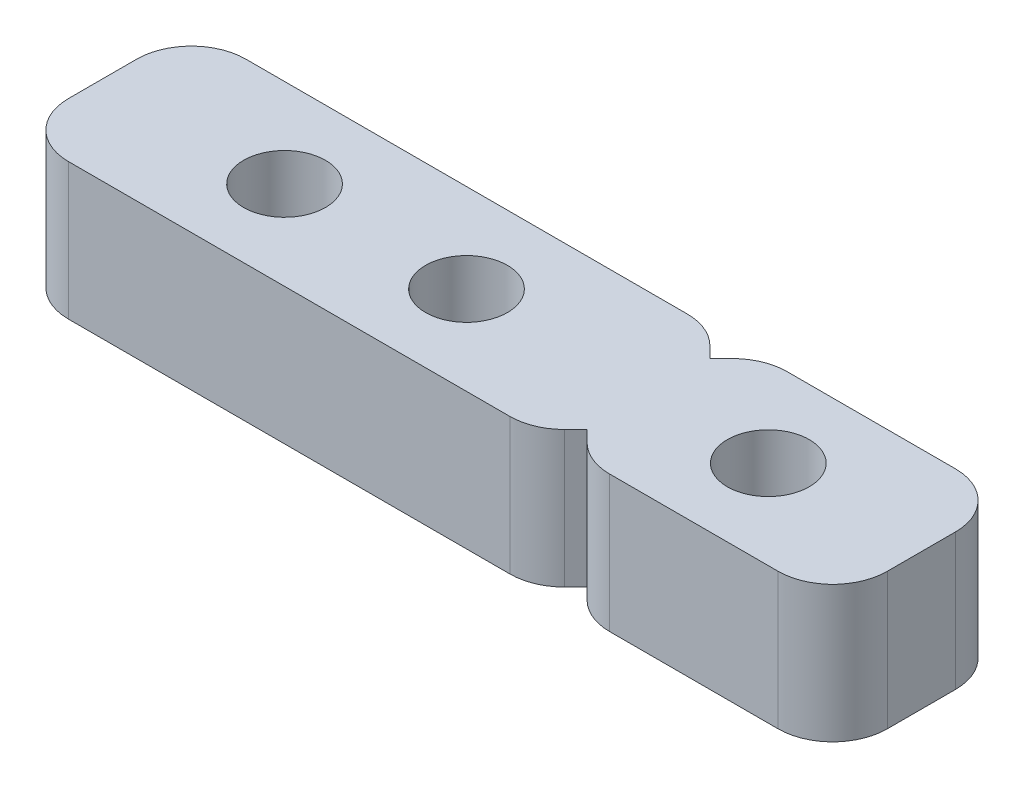
from build123d import *

# Parameters (mm, degrees)
SKETCH1_R           = 1.905
BOSS_EXTRUDE1_DEPTH = 6.35
FILLET1_R           = 2.54


with BuildPart() as part:
    # Sketch1 → Boss-Extrude1 (new body)
    with BuildSketch(Plane(origin=(0, 0, 0), x_dir=(1, 0, 0), z_dir=(0, 1, 0))):
        Polygon((-21.076124124, -4.521243568), (-19.806124124, -5.791243568), (-18.536124124, -4.521243568), (-7.106124124, -4.521243568), (-7.106124124, -12.776243568), (-18.536124124, -12.776243568), (-19.806124124, -11.506243568), (-21.076124124, -12.776243568), (-45.206124124, -12.776243568), (-45.206124124, -4.521243568), align=None)
        with Locations((-36.739457457, -8.648743568)):
            Circle(SKETCH1_R, mode=Mode.SUBTRACT)
        with Locations((-28.272790791, -8.648743568)):
            Circle(SKETCH1_R, mode=Mode.SUBTRACT)
        with Locations((-14.230824124, -8.648743568)):
            Circle(SKETCH1_R, mode=Mode.SUBTRACT)
    extrude(amount=BOSS_EXTRUDE1_DEPTH)

    # Fillet1
    fillet1_edges = [part.edges().sort_by_distance(p)[0] for p in [
        (-45.206124124, 3.175, 4.521243568),
        (-21.076124124, 3.175, 4.521243568),
        (-18.536124124, 3.175, 4.521243568),
        (-7.106124124, 3.175, 4.521243568),
        (-7.106124124, 3.175, 12.776243568),
        (-18.536124124, 3.175, 12.776243568),
        (-21.076124124, 3.175, 12.776243568),
        (-45.206124124, 3.175, 12.776243568),
    ]]
    fillet(fillet1_edges, radius=FILLET1_R)


solid = part.part
